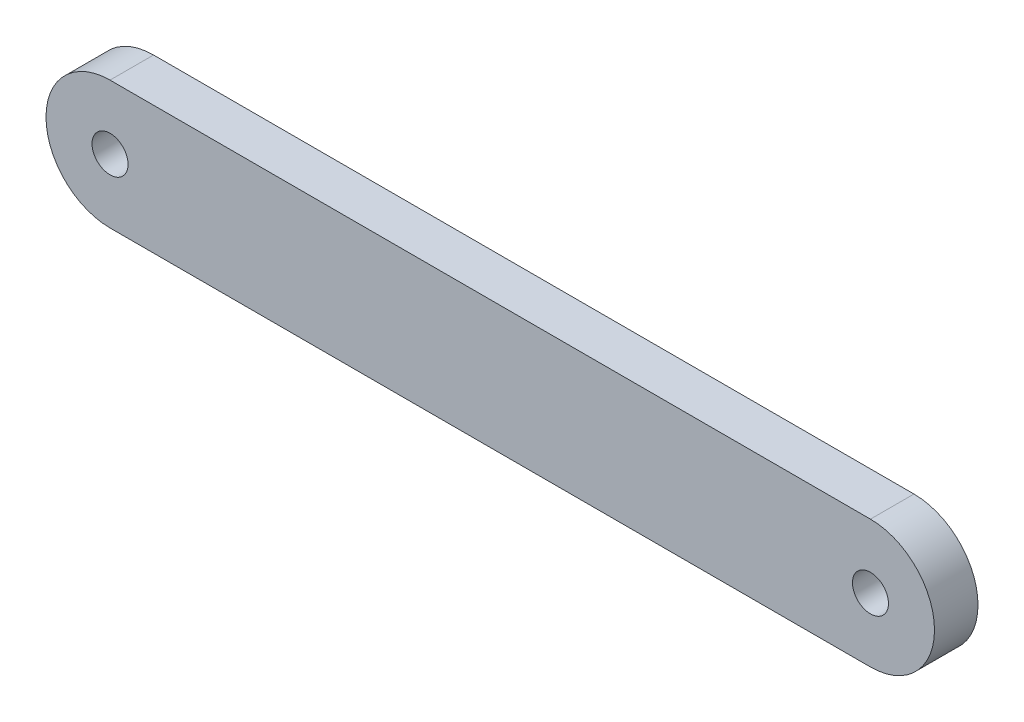
from build123d import *

# Parameters (mm, degrees)
SKETCH2_R           = 2.25
BOSS_EXTRUDE1_DEPTH = 5.4356


with BuildPart() as part:
    # Sketch2 → Boss-Extrude1 (new body)
    with BuildSketch(Plane(origin=(0, 0, 83.955), x_dir=(-1, 0, 0), z_dir=(0, 0, -1))):
        with BuildLine():
            Line((-47.5, 8), (47.5, 8))
            ThreePointArc((47.5, 8), (55.5, 0), (47.5, -8))
            Line((47.5, -8), (-47.5, -8))
            ThreePointArc((-47.5, -8), (-55.5, 0), (-47.5, 8))
        make_face()
        with Locations((-47.5, 0)):
            Circle(SKETCH2_R, mode=Mode.SUBTRACT)
        with Locations((47.5, 0)):
            Circle(SKETCH2_R, mode=Mode.SUBTRACT)
    extrude(amount=BOSS_EXTRUDE1_DEPTH)


solid = part.part
